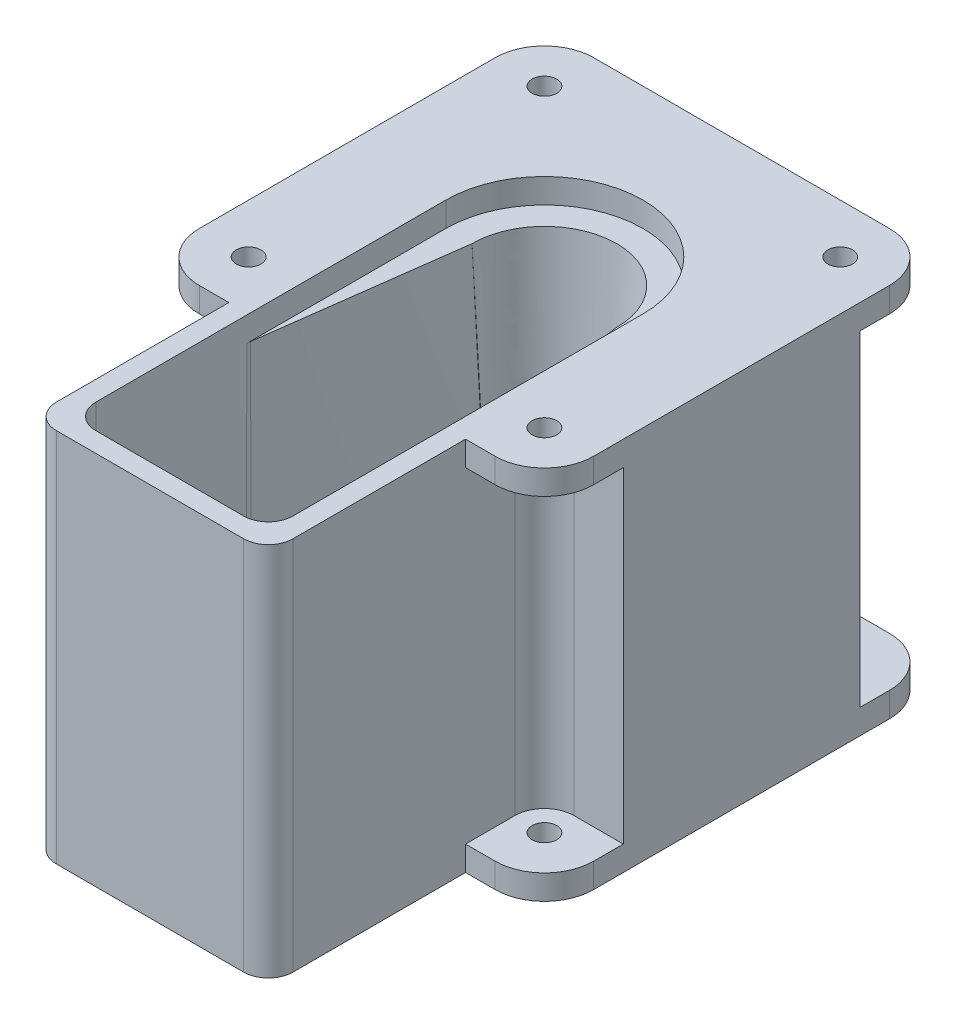
from build123d import *

# Parameters (mm, degrees)
SKETCH1_W                       = 80
SKETCH1_H                       = 40
BOSS_EXTRUDE1_DEPTH             = 76.125
FILLET1_R                       = 10
CUT_EXTRUDE1_START              = -66.125
CUT_EXTRUDE1_DEPTH              = 66.125
SKETCH5_R                       = 2.5
CUT_EXTRUDE2_DEPTH              = 95.842056369
SKETCH6_R                       = 20
CUT_EXTRUDE3_DEPTH              = 5
SKETCH7_W                       = 20
SKETCH7_H                       = 40
BOSS_EXTRUDE3_DEPTH             = 76.125
FILLET2_R                       = 10
MIRROR2_START                   = -66.125
MIRROR2_COPY_1_DEPTH            = 66.125
BOSS_EXTRUDE4_REACH             = 96.842
BOSS_EXTRUDE4_DIRECTION_2_REACH = 96.842
CUT_EXTRUDE4_REACH              = 96.842
SKETCH12_R                      = 10.5
SKETCH13_W                      = 4
SKETCH13_H                      = 76.125
BOSS_EXTRUDE5_DEPTH             = 40
BOSS_EXTRUDE6_REACH             = 127.678
BOSS_EXTRUDE7_REACH             = 119.452
SKETCH15_W                      = 40
SKETCH15_H                      = 4
FILLET3_R                       = 5


with BuildPart() as part:
    # Sketch1 → Boss-Extrude1 (new body)
    with BuildSketch(Plane(origin=(0, 0, 0), x_dir=(1, 0, 0), z_dir=(0, 1, 0))):
        with Locations((0, 20)):
            Rectangle(SKETCH1_W, SKETCH1_H)
    extrude(amount=BOSS_EXTRUDE1_DEPTH)

    # Cut-Loft1: read off the stored shape, not the designer's step
    # Cut-Loft1: loft between two sections, ruled curve by curve
    cut_loft1_from = [
        Edge.make_bspline([(-2.197461017, 76.125, 14.838165826), (-31.873792669, 76.125, 10.443243791), (-27.478870634, 76.125, -19.233087861), (2.197461017, 76.125, -14.838165826), (31.873792669, 76.125, -10.443243791), (27.478870634, 76.125, 19.233087861), (-2.197461017, 76.125, 14.838165826)], [0, 0, 0, 0, 0.5, 0.5, 0.5, 1, 1, 1, 1], 3, [1, 0.333333333, 0.333333333, 1, 0.333333333, 0.333333333, 1]),
    ]
    cut_loft1_to = [
        Edge.make_bspline([(1.080050789, 0, 10.444304203), (-19.808557618, 0, 12.604405781), (-21.968659196, 0, -8.284202626), (-1.080050789, 0, -10.444304203), (19.808557618, 0, -12.604405781), (21.968659196, 0, 8.284202626), (1.080050789, 0, 10.444304203)], [0, 0, 0, 0, 0.5, 0.5, 0.5, 1, 1, 1, 1], 3, [1, 0.333333333, 0.333333333, 1, 0.333333333, 0.333333333, 1]),
    ]
    cut_loft1 = Solid(Shell([*[Face.make_surface_from_curves(cut_loft1_from[k], cut_loft1_to[k]) for k in range(1)], Face(Wire(cut_loft1_from)), Face(Wire(cut_loft1_to))]))
    add(cut_loft1, mode=Mode.SUBTRACT)

    # Fillet1
    fillet1_edges = [part.edges().sort_by_distance(p)[0] for p in [
        (-40, 38.0625, -40),
        (40, 38.0625, -40),
    ]]
    fillet(fillet1_edges, radius=FILLET1_R)

    # Sketch4 → Cut-Extrude1 (cut)
    with BuildSketch(Plane(origin=(0, 5, 0), x_dir=(-1, 0, 0), z_dir=(0, -1, 0)).offset(CUT_EXTRUDE1_START)):
        with BuildLine():
            Line((-40, 24), (-40, 30))
            ThreePointArc((-40, 30), (-37.071067812, 37.071067812), (-30, 40))
            Line((-30, 40), (-24, 40))
            Line((-24, 40), (-24, 30))
            ThreePointArc((-24, 30), (-25.757359313, 25.757359313), (-30, 24))
            Line((-30, 24), (-40, 24))
        make_face()
    cut_extrude1 = extrude(amount=CUT_EXTRUDE1_DEPTH, mode=Mode.SUBTRACT)

    # Sketch5 → Cut-Extrude2 (cut, through all)
    with BuildSketch(Plane(origin=(0, 76.125, 0), x_dir=(1, 0, 0), z_dir=(0, 1, 0))):
        with Locations(Location((30, 30, 0), (0, 0, 270))):
            Circle(SKETCH5_R)
        with Locations(Location((-30, 30, 0), (0, 0, 270))):
            Circle(SKETCH5_R)
    cut_extrude2 = extrude(amount=-CUT_EXTRUDE2_DEPTH, mode=Mode.SUBTRACT)

    # Sketch6 → Cut-Extrude3 (cut)
    with BuildSketch(Plane(origin=(0, 76.125, 0), x_dir=(1, 0, 0), z_dir=(0, 1, 0))):
        Circle(SKETCH6_R)
    extrude(amount=-CUT_EXTRUDE3_DEPTH, mode=Mode.SUBTRACT)

    # Mirror1: Cut-Extrude1 across plane
    add(cut_extrude1.mirror(Plane(origin=(0, 0, 0), x_dir=(0, 0, 1), z_dir=(1, 0, 0))), mode=Mode.SUBTRACT)

    # Sketch7 → Boss-Extrude3 (add)
    with BuildSketch(Plane(origin=(0, 76.125, 0), x_dir=(1, 0, 0), z_dir=(0, 1, 0))):
        with Locations((-30, -20)):
            Rectangle(SKETCH7_W, SKETCH7_H)
        with Locations((30, -20)):
            Rectangle(SKETCH7_W, SKETCH7_H)
    extrude(amount=-BOSS_EXTRUDE3_DEPTH)

    # Fillet2
    fillet2_edges = [part.edges().sort_by_distance(p)[0] for p in [
        (-40, 38.0625, 40),
        (40, 38.0625, 40),
    ]]
    fillet(fillet2_edges, radius=FILLET2_R)

    # Mirror2: Cut-Extrude1, Cut-Extrude2 across plane
    add(cut_extrude1.mirror(Plane.XY), mode=Mode.SUBTRACT)
    add(cut_extrude2.mirror(Plane.XY), mode=Mode.SUBTRACT)

    # Mirror2 copy 1 sketch → Mirror2 copy 1 (cut)
    with BuildSketch(Plane.XZ.offset(-5).offset(MIRROR2_START)):
        with BuildLine():
            Line((-40, 24), (-40, 30))
            ThreePointArc((-40, 30), (-37.071067812, 37.071067812), (-30, 40))
            Line((-30, 40), (-24, 40))
            Line((-24, 40), (-24, 30))
            ThreePointArc((-24, 30), (-25.757359313, 25.757359313), (-30, 24))
            Line((-30, 24), (-40, 24))
        make_face()
    extrude(amount=MIRROR2_COPY_1_DEPTH, mode=Mode.SUBTRACT)

    # Sketch9 → Loft1 section 0
    with BuildSketch(Plane.XZ):
        with BuildLine():
            Line((20, 40), (20, 0))
            Line((20, 0), (10.5, 0))
            Line((10.5, 0), (20, 40))
        make_face()
    # Sketch8 → Loft1 section 1
    with BuildSketch(Plane(origin=(0, 71.125, 0), x_dir=(1, 0, 0), z_dir=(0, 1, 0))):
        with BuildLine():
            Line((14.683973591, 0), (20, -40))
            Line((20, -40), (20, 0))
            Line((20, 0), (14.683973591, 0))
        make_face()
    loft1 = loft()

    # Mirror3: Loft1 across plane
    add(loft1.mirror(Plane(origin=(0, 0, 0), x_dir=(0, 0, 1), z_dir=(1, 0, 0))))

    # Sketch11 → Boss-Extrude4 (add, up to next)
    with BuildSketch(Plane(origin=(0, 0, 0), x_dir=(0, 0, -1), z_dir=(1, 0, 0)), mode=Mode.PRIVATE) as boss_extrude4_sk1:
        Polygon((0, 0), (-40, 0), (-40, 10), (0, 0.5), align=None)
    boss_extrude4_tool1 = extrude(boss_extrude4_sk1.sketch, amount=BOSS_EXTRUDE4_REACH, mode=Mode.PRIVATE) - part.part
    add(boss_extrude4_tool1.solids().sort_by_distance((0, 3.34127, 26.031746))[0])

    # Sketch11 → Boss-Extrude4 direction 2 (add, up to next)
    with BuildSketch(Plane(origin=(0, 0, 0), x_dir=(0, 0, -1), z_dir=(1, 0, 0)), mode=Mode.PRIVATE) as boss_extrude4_direction_2_sk1:
        Polygon((0, 0), (-40, 0), (-40, 10), (0, 0.5), align=None)
    boss_extrude4_direction_2_tool1 = extrude(boss_extrude4_direction_2_sk1.sketch, amount=-BOSS_EXTRUDE4_DIRECTION_2_REACH, mode=Mode.PRIVATE) - part.part
    add(boss_extrude4_direction_2_tool1.solids().sort_by_distance((0, 3.34127, 26.031746))[0])

    # Sketch12 → Cut-Extrude4 (cut, up to next)
    with BuildSketch(Plane(origin=(0, 0, 0), x_dir=(-1, 0, 0), z_dir=(0, -1, 0)), mode=Mode.PRIVATE) as cut_extrude4_sk1:
        Circle(SKETCH12_R)
    cut_extrude4_tool1 = extrude(cut_extrude4_sk1.sketch, amount=-CUT_EXTRUDE4_REACH, mode=Mode.PRIVATE) & part.part
    add(cut_extrude4_tool1.solids().sort_by_distance((0, 0, 0))[0], mode=Mode.SUBTRACT)

    # Sketch13 → Boss-Extrude5 (add)
    with BuildSketch(Plane.XY.offset(40)):
        with Locations((-22, 38.0625)):
            Rectangle(SKETCH13_W, SKETCH13_H)
    boss_extrude5 = extrude(amount=BOSS_EXTRUDE5_DEPTH)

    # Mirror4: Boss-Extrude5 across plane
    add(boss_extrude5.mirror(Plane(origin=(0, 0, 0), x_dir=(0, 0, 1), z_dir=(1, 0, 0))))

    # Sketch14 → Boss-Extrude6 (add, up to next)
    with BuildSketch(Plane(origin=(-20, 0, 0), x_dir=(0, 0, -1), z_dir=(1, 0, 0)), mode=Mode.PRIVATE) as boss_extrude6_sk1:
        Polygon((-40, 10), (-80, 19.5), (-80, 0), (-40, 0), align=None)
    boss_extrude6_tool1 = extrude(boss_extrude6_sk1.sketch, amount=BOSS_EXTRUDE6_REACH, mode=Mode.PRIVATE) - part.part
    add(boss_extrude6_tool1.solids().sort_by_distance((-20, 7.629944, 62.146893))[0])

    # Boss-Extrude7: up to this plane
    boss_extrude7_end = Plane(origin=(-500000, 0.5, 0), z_dir=(0, 0.9729365507195606, -0.23107243079589554))
    # Sketch15 → Boss-Extrude7 (add, up to the surface)
    with BuildSketch(Plane(origin=(0, 76.125, 0), x_dir=(1, 0, 0), z_dir=(0, 1, 0)), mode=Mode.PRIVATE) as boss_extrude7_sk1:
        with Locations((0, -78)):
            Rectangle(SKETCH15_W, SKETCH15_H)
    boss_extrude7_tool1 = split(extrude(boss_extrude7_sk1.sketch, amount=-BOSS_EXTRUDE7_REACH, mode=Mode.PRIVATE), bisect_by=boss_extrude7_end, keep=Keep.BOTH, mode=Mode.PRIVATE)
    add(boss_extrude7_tool1.solids().sort_by_distance((0, 76.125, 78))[0])

    # Fillet3
    fillet3_edges = [part.edges().sort_by_distance(p)[0] for p in [
        (-20, 40.5625, 40),
        (20, 40.5625, 40),
        (-24, 38.0625, 80),
        (24, 38.0625, 80),
        (-20, 14.275, 58),
        (20, 14.275, 58),
        (0, 18.55, 76),
        (-20, 47.3375, 76),
        (20, 47.3375, 76),
    ]]
    fillet(fillet3_edges, radius=FILLET3_R)


solid = part.part
